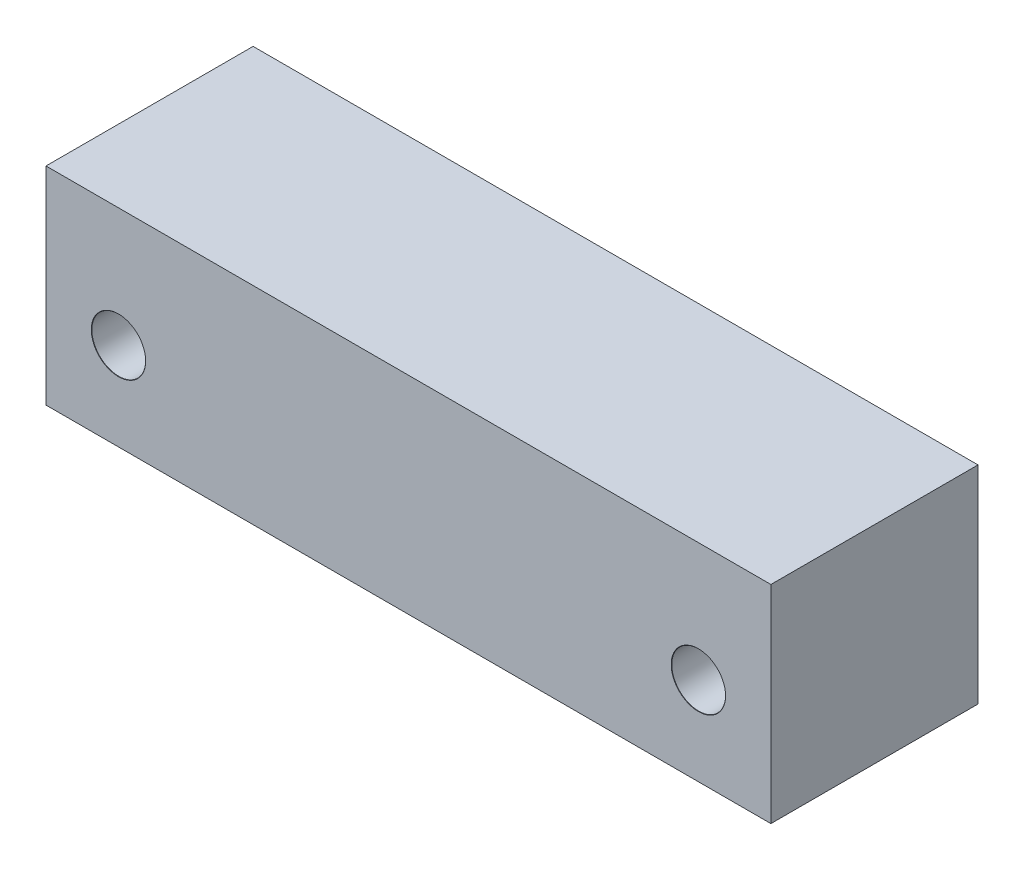
from build123d import *

# Parameters (mm, degrees)
SKIZZE1_W                                  = 70
SKIZZE1_H                                  = 20
AUFSATZ_LINEAR_AUSTRAGEN1_DEPTH            = 20
F_5_2_5_2_DURCHMESSER_BOHRUNG1_D           = 5.2
F_5_2_5_2_DURCHMESSER_BOHRUNG1_CSINK_D     = 5.25
F_5_2_5_2_DURCHMESSER_BOHRUNG1_CSINK_ANGLE = 90
SKIZZE21_R                                 = 6.05
SCHNITT_LINEAR_AUSTRAGEN3_DEPTH            = 7
SKIZZE22_R                                 = 4
SCHNITT_LINEAR_AUSTRAGEN5_DEPTH            = 10


# Read off the part's stored shape, not the designer's step: Durchgangsloch für M3.51
with BuildPart() as part:
    # Skizze1 → Aufsatz-Linear austragen1 (new body)
    with BuildSketch(Plane.XY):
        with Locations((0, 1.677024639)):
            Rectangle(SKIZZE1_W, SKIZZE1_H)
    extrude(amount=AUFSATZ_LINEAR_AUSTRAGEN1_DEPTH)

    # Ø5.2 (5.2) Durchmesser Bohrung1 (through all)
    with Locations(Plane.XY.offset(20)):
        with Locations((-28, 0.177024639), (28, 0.177024639)):
            CounterSinkHole(F_5_2_5_2_DURCHMESSER_BOHRUNG1_D / 2, F_5_2_5_2_DURCHMESSER_BOHRUNG1_CSINK_D / 2, counter_sink_angle=F_5_2_5_2_DURCHMESSER_BOHRUNG1_CSINK_ANGLE)

    # Durchgangsloch für M3.51 outline → Durchgangsloch für M3.51 (revolve, cut)
    with BuildSketch(Plane(origin=(-28, 0, 10), x_dir=(1, 0, 0), z_dir=(0, 0, 1))):
        Polygon((1.85, -8.297975361), (1.85, -1.649435315), (0, -1.649435315), (0, -8.322975361), (1.875, -8.322975361), align=None)
    revolve(axis=Axis((-28, 0, 10), (0, 1, 0)), mode=Mode.SUBTRACT)

    # Durchgangsloch f_r M3.51 2 outline → Durchgangsloch f_r M3.51 2 (revolve, cut)
    with BuildSketch(Plane(origin=(28, 0, 10), x_dir=(1, 0, 0), z_dir=(0, 0, 1))):
        Polygon((1.85, -8.297975361), (1.85, -1.649435315), (0, -1.649435315), (0, -8.322975361), (1.875, -8.322975361), align=None)
    revolve(axis=Axis((28, 0, 10), (0, 1, 0)), mode=Mode.SUBTRACT)

    # Skizze21 → Schnitt-Linear austragen3 (cut)
    with BuildSketch(Plane(origin=(0, 0, 0), x_dir=(-1, 0, 0), z_dir=(0, 0, -1))):
        Circle(SKIZZE21_R)
    extrude(amount=-SCHNITT_LINEAR_AUSTRAGEN3_DEPTH, mode=Mode.SUBTRACT)

    # Skizze22 → Schnitt-Linear austragen5 (cut)
    with BuildSketch(Plane(origin=(0, 0, 7), x_dir=(-1, 0, 0), z_dir=(0, 0, -1))):
        Circle(SKIZZE22_R)
    extrude(amount=-SCHNITT_LINEAR_AUSTRAGEN5_DEPTH, mode=Mode.SUBTRACT)


solid = part.part
